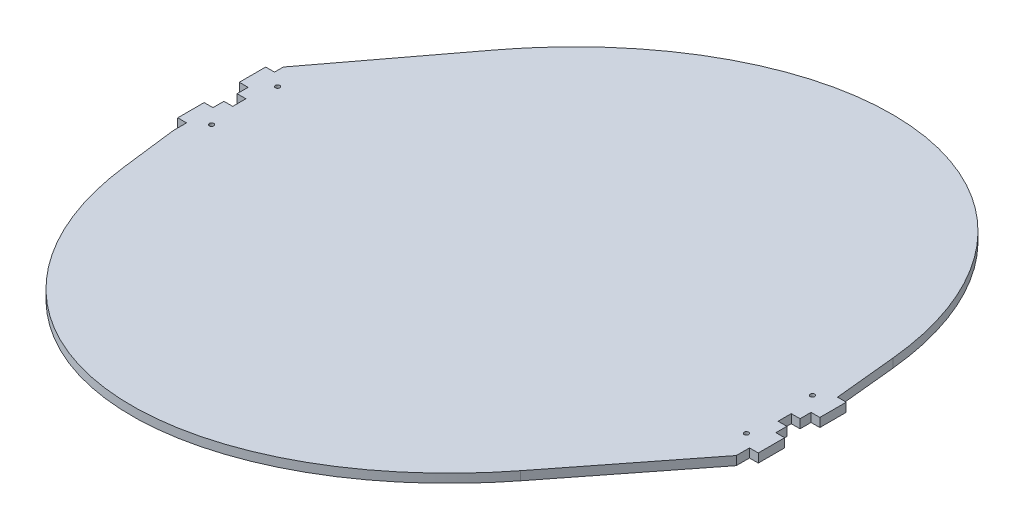
from build123d import *

# Parameters (mm, degrees)
BOSS_EXTRUDE1_DEPTH          = 10
SKETCH2_W                    = 10
SKETCH2_H                    = 15
CUT_EXTRUDE1_DEPTH           = 10
F_5_0_5_DIAMETER_HOLE2_D     = 5
F_5_0_5_DIAMETER_HOLE2_DEPTH = 25
F_5_0_5_DIAMETER_HOLE2_TIP   = 1.502151548


with BuildPart() as part:
    # Sketch1 → Boss-Extrude1 (new body)
    with BuildSketch(Plane(origin=(0, 0, 0), x_dir=(1, 0, 0), z_dir=(0, 1, 0))):
        with BuildLine():
            Line((-320, -65), (-312.170159719, -128.33520269))
            add(Edge.make_bspline(
                [(-312.170159719, -128.33520269), (-232.721291269, -770.993291043), (212.28214963, -202.588475219)],
                knots=[5.492316601, 5.492316601, 5.492316601, 7.67057167, 7.67057167, 7.67057167], degree=2, weights=[1, 0.463258742, 1]))
            Line((212.28214963, -202.588475219), (320, -65))
            Line((320, -65), (320, -50))
            Line((320, -50), (330, -50))
            Line((330, -50), (330, -20))
            Line((330, -20), (320, -20))
            Line((320, -20), (320, 20))
            Line((320, 20), (330, 20))
            Line((330, 20), (330, 50))
            Line((330, 50), (320, 50))
            Line((320, 50), (320, 51))
            Line((320, 51), (313.091302172, 120.09271769))
            add(Edge.make_bspline(
                [(313.091302172, 120.09271769), (244.337364097, 807.689215884), (-217.547896668, 195.738545202)],
                knots=[2.326299806, 2.326299806, 2.326299806, 4.55185667, 4.55185667, 4.55185667], degree=2, weights=[1, 0.442171166, 1]))
            Line((-217.547896668, 195.738545202), (-320, 60))
            Line((-320, 60), (-320, 50))
            Line((-320, 50), (-330, 50))
            Line((-330, 50), (-330, 20))
            Line((-330, 20), (-320, 20))
            Line((-320, 20), (-320, -20))
            Line((-320, -20), (-330, -20))
            Line((-330, -20), (-330, -50))
            Line((-330, -50), (-320, -50))
            Line((-320, -50), (-320, -65))
        make_face()
    extrude(amount=BOSS_EXTRUDE1_DEPTH)

    # Sketch2 → Cut-Extrude1 (cut)
    with BuildSketch(Plane.XZ):
        with Locations((315, 0)):
            Rectangle(SKETCH2_W, SKETCH2_H)
        with Locations((-315, 0)):
            Rectangle(SKETCH2_W, SKETCH2_H)
    extrude(amount=-CUT_EXTRUDE1_DEPTH, mode=Mode.SUBTRACT)

    # Ø5.0 (5) Diameter Hole2
    with Locations(Plane(origin=(0, -10, 0), x_dir=(-1, 0, 0), z_dir=(0, -1, 0))):
        with Locations((304, 37.5), (304, -37.5), (-304, -37.5), (-304, 37.5)):
            Hole(F_5_0_5_DIAMETER_HOLE2_D / 2, depth=F_5_0_5_DIAMETER_HOLE2_DEPTH)
            with Locations((0, 0, -(F_5_0_5_DIAMETER_HOLE2_DEPTH + F_5_0_5_DIAMETER_HOLE2_TIP / 2))):  # 118° drill point
                Cone(0, F_5_0_5_DIAMETER_HOLE2_D / 2, F_5_0_5_DIAMETER_HOLE2_TIP, mode=Mode.SUBTRACT)


solid = part.part
